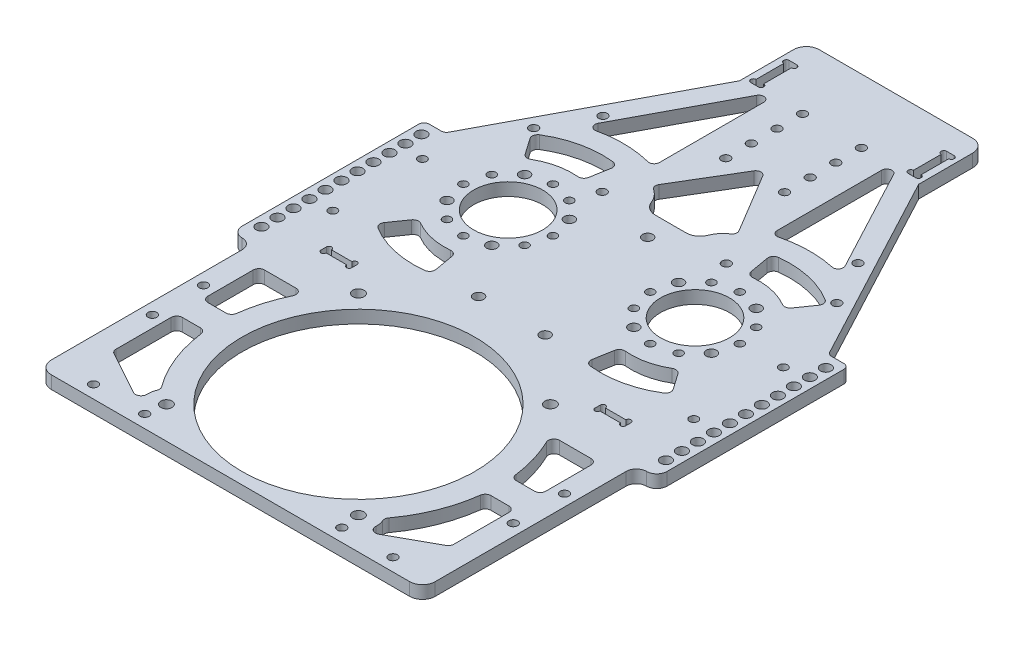
from build123d import *

# Parameters (mm, degrees)
SKETCH_1_R                   = 13.5
SKETCH_1_R_2                 = 1.6
SKETCH_1_R_3                 = 45.5
EXTRUDE_1_DEPTH              = 5
SKETCH_3_R                   = 1.7
CUT_EXTRUDE_2_DEPTH          = 164.324829711
SKETCH_4_R                   = 2.2
CUT_EXTRUDE_3_DEPTH          = 164.324829711
CUT_EXTRUDE_4_DEPTH          = 10
CUT_EXTRUDE_5_DEPTH          = 10
FILLET_1_DEPTH               = 5
CUT_EXTRUDE_6_DEPTH          = 10
FILLET_2_R                   = 2
CUT_EXTRUDE_7_DEPTH          = 164.324829711
FILLET_3_R                   = 2
FILLET_5_R                   = 5
SKETCH_9_R                   = 1.05
SKETCH_9_W                   = 3
SKETCH_9_H                   = 15
CUT_EXTRUDE_8_DEPTH          = 164.324829711
FILLET_3_OF_MIRROR_1_R       = 2
FILLET_6_R                   = 20
EXTRUDE_START                = -5
EXTRUDE_2_DEPTH              = 5
FILLET_7_R                   = 2.2
SKETCH_12_R                  = 1
SKETCH_12_W                  = 12
SKETCH_12_H                  = 2.1
CUT_EXTRUDE_10_DEPTH         = 10
SKETCH_14_R                  = 1.5
CUT_EXTRUDE_11_DEPTH         = 164.324829711
CUT_EXTRUDE_12_DEPTH         = 164.324829711
FILLET_8_R                   = 10
SKETCH_16_W                  = 8
SKETCH_16_H                  = 75.05079277
EXTRUDE_3_DEPTH              = 5
FILLET_START                 = -1
FILLET_9_DEPTH               = 7
FILLET_9_2_DEPTH             = 5
SKETCH_17_R                  = 1.65
CUT_EXTRUDE_13_DEPTH         = 168.149633702
SKETCH_18_R                  = 2.1
CUT_EXTRUDE_14_DEPTH         = 168.149633702
SKETCH_20_R                  = 2
CUT_EXTRUDE_16_DEPTH         = 10
SKETCH_23_R                  = 1.65
CUT_EXTRUDE_17_DEPTH         = 10
FILLET_10_R                  = 2
SKETCH_19_R                  = 2
CUT_EXTRUDE_18_DEPTH         = 10
SKETCH_24_R                  = 2
CUT_EXTRUDE_19_DEPTH         = 10
SKETCH_25_W                  = 49.263318026
SKETCH_25_H                  = 14.404478955
EXTRUDE_4_DEPTH              = 5
HOLE_WIZARD_M3_1_D           = 3.4
HOLE_WIZARD_M3_1_DEPTH       = 7.5
HOLE_WIZARD_M3_1_CSINK_D     = 6.72
HOLE_WIZARD_M3_1_CSINK_ANGLE = 90
HOLE_WIZARD_M3_1_TIP         = 1.021463052


with BuildPart() as part:
    # 草图1 → 凸台-拉伸1 (new body)
    with BuildSketch(Plane(origin=(0, 0, 0), x_dir=(1, 0, 0), z_dir=(0, 1, 0))):
        Polygon((-35, 88.881349096), (-75, 13.627385249), (-75, -145), (75, -145), (75, 13.627385249), (35, 88.881349096), (35, 115), (-35, 115), align=None)
        with Locations(Location((36.5, 0, 0), (0, 0, 270))):
            Circle(SKETCH_1_R, mode=Mode.SUBTRACT)
        with Locations(Location((-36.5, 0, 0), (0, 0, 270))):
            Circle(SKETCH_1_R, mode=Mode.SUBTRACT)
        with Locations(Location((36.5, 17.5, 0), (0, 0, 270))):
            Circle(SKETCH_1_R_2, mode=Mode.SUBTRACT)
        with Locations(Location((51.655444566, 8.75, 0), (0, 0, 270))):
            Circle(SKETCH_1_R_2, mode=Mode.SUBTRACT)
        with Locations(Location((54, 0, 0), (0, 0, 270))):
            Circle(SKETCH_1_R_2, mode=Mode.SUBTRACT)
        with Locations(Location((45.25, -15.155444566, 0), (0, 0, 270))):
            Circle(SKETCH_1_R_2, mode=Mode.SUBTRACT)
        with Locations(Location((36.5, -17.5, 0), (0, 0, 270))):
            Circle(SKETCH_1_R_2, mode=Mode.SUBTRACT)
        with Locations(Location((21.344555434, -8.75, 0), (0, 0, 270))):
            Circle(SKETCH_1_R_2, mode=Mode.SUBTRACT)
        with Locations(Location((19, 0, 0), (0, 0, 270))):
            Circle(SKETCH_1_R_2, mode=Mode.SUBTRACT)
        with Locations(Location((27.75, 15.155444566, 0), (0, 0, 270))):
            Circle(SKETCH_1_R_2, mode=Mode.SUBTRACT)
        with Locations(Location((27.75, -15.155444566, 0), (0, 0, 270))):
            Circle(SKETCH_1_R_2, mode=Mode.SUBTRACT)
        with Locations(Location((21.344555434, 8.75, 0), (0, 0, 270))):
            Circle(SKETCH_1_R_2, mode=Mode.SUBTRACT)
        with Locations(Location((45.25, 15.155444566, 0), (0, 0, 270))):
            Circle(SKETCH_1_R_2, mode=Mode.SUBTRACT)
        with Locations(Location((51.655444566, -8.75, 0), (0, 0, 270))):
            Circle(SKETCH_1_R_2, mode=Mode.SUBTRACT)
        with Locations(Location((-36.5, -17.5, 0), (0, 0, 270))):
            Circle(SKETCH_1_R_2, mode=Mode.SUBTRACT)
        with Locations(Location((-45.25, -15.155444566, 0), (0, 0, 270))):
            Circle(SKETCH_1_R_2, mode=Mode.SUBTRACT)
        with Locations(Location((-51.655444566, 8.75, 0), (0, 0, 270))):
            Circle(SKETCH_1_R_2, mode=Mode.SUBTRACT)
        with Locations(Location((-36.5, 17.5, 0), (0, 0, 270))):
            Circle(SKETCH_1_R_2, mode=Mode.SUBTRACT)
        with Locations(Location((-27.75, 15.155444566, 0), (0, 0, 270))):
            Circle(SKETCH_1_R_2, mode=Mode.SUBTRACT)
        with Locations(Location((-21.344555434, -8.75, 0), (0, 0, 270))):
            Circle(SKETCH_1_R_2, mode=Mode.SUBTRACT)
        with Locations(Location((-21.344555434, 8.75, 0), (0, 0, 270))):
            Circle(SKETCH_1_R_2, mode=Mode.SUBTRACT)
        with Locations(Location((-19, 0, 0), (0, 0, 270))):
            Circle(SKETCH_1_R_2, mode=Mode.SUBTRACT)
        with Locations(Location((-27.75, -15.155444566, 0), (0, 0, 270))):
            Circle(SKETCH_1_R_2, mode=Mode.SUBTRACT)
        with Locations(Location((-51.655444566, -8.75, 0), (0, 0, 270))):
            Circle(SKETCH_1_R_2, mode=Mode.SUBTRACT)
        with Locations(Location((-54, 0, 0), (0, 0, 270))):
            Circle(SKETCH_1_R_2, mode=Mode.SUBTRACT)
        with Locations(Location((-45.25, 15.155444566, 0), (0, 0, 270))):
            Circle(SKETCH_1_R_2, mode=Mode.SUBTRACT)
        with Locations(Location((0, -95, 0), (0, 0, 270))):
            Circle(SKETCH_1_R_3, mode=Mode.SUBTRACT)
    extrude(amount=EXTRUDE_1_DEPTH)

    # 草图3 → 切除-拉伸2 (cut, through all)
    with BuildSketch(Plane(origin=(0, 5, 0), x_dir=(1, 0, 0), z_dir=(0, 1, 0))):
        with Locations(Location((49.82296811, 50.341150246, 0), (0, 0, 270))):
            Circle(SKETCH_3_R)
        with Locations(Location((59.209976564, 32.680910376, 0), (0, 0, 270))):
            Circle(SKETCH_3_R)
        with Locations(Location((24.25, 24.5, 0), (0, 0, 270))):
            Circle(SKETCH_3_R)
        with Locations(Location((70.5, -85, 0), (0, 0, 270))):
            Circle(SKETCH_3_R)
        with Locations(Location((70.5, -105, 0), (0, 0, 270))):
            Circle(SKETCH_3_R)
        with Locations(Location((58.5, -140, 0), (0, 0, 270))):
            Circle(SKETCH_3_R)
        with Locations(Location((38.5, -140, 0), (0, 0, 270))):
            Circle(SKETCH_3_R)
        with Locations(Location((21, 103, 0), (0, 0, 270))):
            Circle(SKETCH_3_R)
        with Locations(Location((-21, 103, 0), (0, 0, 90))):
            Circle(SKETCH_3_R)
        with Locations(Location((-38.5, -140, 0), (0, 0, 90))):
            Circle(SKETCH_3_R)
        with Locations(Location((-58.5, -140, 0), (0, 0, 90))):
            Circle(SKETCH_3_R)
        with Locations(Location((-70.5, -105, 0), (0, 0, 90))):
            Circle(SKETCH_3_R)
        with Locations(Location((-70.5, -85, 0), (0, 0, 90))):
            Circle(SKETCH_3_R)
        with Locations(Location((-24.25, 24.5, 0), (0, 0, 90))):
            Circle(SKETCH_3_R)
        with Locations(Location((-59.209976564, 32.680910376, 0), (0, 0, 90))):
            Circle(SKETCH_3_R)
        with Locations(Location((-49.82296811, 50.341150246, 0), (0, 0, 90))):
            Circle(SKETCH_3_R)
    extrude(amount=-CUT_EXTRUDE_2_DEPTH, mode=Mode.SUBTRACT)

    # 草图4 → 切除-拉伸3 (cut, through all)
    with BuildSketch(Plane(origin=(0, 5, 0), x_dir=(1, 0, 0), z_dir=(0, 1, 0))):
        with Locations(Location((37.500010402, -57.500010402, 0), (0, 0, 270))):
            Circle(SKETCH_4_R)
        with Locations(Location((37.499989598, -132.500010402, 0), (0, 0, 270))):
            Circle(SKETCH_4_R)
        with Locations(Location((-37.500010402, -132.499989598, 0), (0, 0, 270))):
            Circle(SKETCH_4_R)
        with Locations(Location((-37.499989598, -57.499989598, 0), (0, 0, 270))):
            Circle(SKETCH_4_R)
    extrude(amount=-CUT_EXTRUDE_3_DEPTH, mode=Mode.SUBTRACT)

    # 草图5 → 切除-拉伸4 (cut)
    with BuildSketch(Plane(origin=(0, 5, 0), x_dir=(1, 0, 0), z_dir=(0, 1, 0))):
        with BuildLine():
            ThreePointArc((57.722328145, 30.308625639), (44.508265716, 36.122952263), (30.075017426, 36.437886861))
            Line((30.075017426, 36.437886861), (32.158795558, 24.620193825))
            ThreePointArc((32.158795558, 24.620193825), (41.910990348, 24.407400178), (50.839410909, 20.478801107))
            Line((50.839410909, 20.478801107), (57.722328145, 30.308625639))
        make_face()
        with BuildLine():
            Line((57.722328145, -30.308625639), (50.839410909, -20.478801107))
            ThreePointArc((50.839410909, -20.478801107), (41.910990348, -24.407400178), (32.158795558, -24.620193825))
            Line((32.158795558, -24.620193825), (30.075017426, -36.437886861))
            ThreePointArc((30.075017426, -36.437886861), (44.508265716, -36.122952263), (57.722328145, -30.308625639))
        make_face()
    cut_extrude_4 = extrude(amount=-CUT_EXTRUDE_4_DEPTH, mode=Mode.SUBTRACT)

    # 草图6 → 切除-拉伸5 (cut)
    with BuildSketch(Plane(origin=(0, 5, 0), x_dir=(1, 0, 0), z_dir=(0, 1, 0))):
        with BuildLine():
            Line((54.772255751, -90), (66, -90))
            Line((66, -90), (66, -40))
            Line((66, -40), (35.155020781, -50.800280654))
            ThreePointArc((35.155020781, -50.800280654), (41.609354889, -51.710460841), (44.601387055, -57.501367529))
            ThreePointArc((44.601387055, -57.501367529), (44.316479978, -59.49247487), (43.484624113, -61.323784866))
            ThreePointArc((43.484624113, -61.323784866), (51.177973179, -74.855148021), (54.772255751, -90))
        make_face()
        with BuildLine():
            Line((40.977955081, -138.804275316), (66, -125))
            Line((66, -125), (66, -100))
            Line((66, -100), (54.772255751, -100))
            ThreePointArc((54.772255751, -100), (51.197014926, -115.096409198), (43.548287119, -128.593848975))
            ThreePointArc((43.548287119, -128.593848975), (44.406064538, -130.463805863), (44.699989598, -132.500010402))
            ThreePointArc((44.699989598, -132.500010402), (43.700044093, -136.160519146), (40.977955081, -138.804275316))
        make_face()
    cut_extrude_5 = extrude(amount=-CUT_EXTRUDE_5_DEPTH, mode=Mode.SUBTRACT)

    # 圆角1: read off the stored shape, not the designer's step
    # 圆角1 outline → 圆角1 (add)
    with BuildSketch(Plane(origin=(0, 0, 0), x_dir=(1, 0, 0), z_dir=(0, 1, 0))):
        with BuildLine():
            ThreePointArc((41.960642067, -51.976420042), (41.174517984, -49.889816616), (42.615339986, -48.188071367))
            Line((42.615339986, -48.188071367), (35.155020781, -50.800280654))
            ThreePointArc((35.155020781, -50.800280654), (38.710477899, -50.505075702), (41.960642067, -51.976420042))
        make_face()
        with BuildLine():
            ThreePointArc((44.303017676, -62.407936169), (43.890494612, -61.363736932), (44.046939144, -60.251957982))
            ThreePointArc((44.046939144, -60.251957982), (43.788663301, -60.799875889), (43.484624113, -61.323784866))
            ThreePointArc((43.484624113, -61.323784866), (43.897168004, -61.863333884), (44.303017676, -62.407936169))
        make_face()
        with BuildLine():
            Line((66, -90), (66, -87.8))
            ThreePointArc((66, -87.8), (65.355634919, -89.355634919), (63.8, -90))
            Line((63.8, -90), (66, -90))
        make_face()
        with BuildLine():
            ThreePointArc((56.745043836, -90), (55.290607652, -89.450640901), (54.56254215, -88.076923077))
            ThreePointArc((54.56254215, -88.076923077), (54.675854491, -89.037539453), (54.772255751, -90))
            Line((54.772255751, -90), (56.745043836, -90))
        make_face()
        with BuildLine():
            ThreePointArc((49.136056437, -21.571510789), (50.717433134, -21.320464273), (52.0501639, -22.207935579))
            Line((52.0501639, -22.207935579), (50.839410909, -20.478801107))
            ThreePointArc((50.839410909, -20.478801107), (49.998794881, -21.04239855), (49.136056437, -21.571510789))
        make_face()
        with BuildLine():
            Line((57.722328145, -30.308625639), (56.420533416, -28.449470091))
            ThreePointArc((56.420533416, -28.449470091), (56.771810685, -30.161691184), (55.763814942, -31.589641243))
            ThreePointArc((55.763814942, -31.589641243), (56.753202111, -30.964621817), (57.722328145, -30.308625639))
        make_face()
        with BuildLine():
            ThreePointArc((31.792244499, -26.699008186), (32.62504719, -25.331449672), (34.164358047, -24.890656413))
            ThreePointArc((34.164358047, -24.890656413), (33.158838982, -24.775726892), (32.158795558, -24.620193825))
            Line((32.158795558, -24.620193825), (31.792244499, -26.699008186))
        make_face()
        with BuildLine():
            ThreePointArc((30.075017426, -36.437886861), (31.230579862, -36.622850946), (32.391413782, -36.771177833))
            ThreePointArc((32.391413782, -36.771177833), (30.874381618, -35.903012984), (30.469131041, -34.202757485))
            Line((30.469131041, -34.202757485), (30.075017426, -36.437886861))
        make_face()
        with BuildLine():
            ThreePointArc((34.164358047, 24.890656413), (32.62504719, 25.331449672), (31.792244499, 26.699008186))
            Line((31.792244499, 26.699008186), (32.158795558, 24.620193825))
            ThreePointArc((32.158795558, 24.620193825), (33.158838982, 24.775726892), (34.164358047, 24.890656413))
        make_face()
        with BuildLine():
            Line((30.075017426, 36.437886861), (30.469131041, 34.202757485))
            ThreePointArc((30.469131041, 34.202757485), (30.874381618, 35.903012984), (32.391413782, 36.771177834))
            ThreePointArc((32.391413782, 36.771177834), (31.230579862, 36.622850946), (30.075017426, 36.437886861))
        make_face()
        with BuildLine():
            ThreePointArc((52.0501639, 22.207935579), (50.717433134, 21.320464273), (49.136056437, 21.571510789))
            ThreePointArc((49.136056437, 21.571510789), (49.998794881, 21.04239855), (50.839410909, 20.478801107))
            Line((50.839410909, 20.478801107), (52.0501639, 22.207935579))
        make_face()
        with BuildLine():
            ThreePointArc((57.722328145, 30.308625639), (56.753202111, 30.964621817), (55.763814942, 31.589641243))
            ThreePointArc((55.763814942, 31.589641243), (56.771810685, 30.161691184), (56.420533416, 28.449470091))
            Line((56.420533416, 28.449470091), (57.722328145, 30.308625639))
        make_face()
        with BuildLine():
            ThreePointArc((54.56254215, -101.923076923), (55.290607652, -100.549359099), (56.745043836, -100))
            Line((56.745043836, -100), (54.772255751, -100))
            ThreePointArc((54.772255751, -100), (54.675854491, -100.962460547), (54.56254215, -101.923076923))
        make_face()
        with BuildLine():
            Line((66, -100), (63.8, -100))
            ThreePointArc((63.8, -100), (65.355634919, -100.644365081), (66, -102.2))
            Line((66, -102.2), (66, -100))
        make_face()
        with BuildLine():
            ThreePointArc((44.119965044, -129.668769492), (43.957031096, -128.553274323), (44.36801473, -127.503527022))
            ThreePointArc((44.36801473, -127.503527022), (43.961531288, -128.051229429), (43.548287119, -128.593848975))
            ThreePointArc((43.548287119, -128.593848975), (43.85688731, -129.119204067), (44.119965044, -129.668769492))
        make_face()
        with BuildLine():
            Line((66, -125), (66, -123.701121217))
            ThreePointArc((66, -123.701121217), (65.694461096, -124.81961), (64.862711675, -125.627424385))
            Line((64.862711675, -125.627424385), (66, -125))
        make_face()
        with BuildLine():
            ThreePointArc((47.94758218, -134.959239803), (45.7131074, -134.894917092), (44.688409016, -132.908209218))
            ThreePointArc((44.688409016, -132.908209218), (43.593743824, -136.334871473), (40.977955081, -138.804275316))
            Line((40.977955081, -138.804275316), (47.94758218, -134.959239803))
        make_face()
    fillet_1 = extrude(amount=FILLET_1_DEPTH)

    # 草图7 → 切除-拉伸6 (cut)
    with BuildSketch(Plane.XZ):
        Polygon((17.467619242, -35), (-17.467619242, -35), (0, -64.112698737), align=None)
    extrude(amount=-CUT_EXTRUDE_6_DEPTH, mode=Mode.SUBTRACT)

    # 圆角2
    fillet_2_edges = [part.edges().sort_by_distance(p)[0] for p in [
        (17.467619242, 2.5, -35),
        (0, 2.5, -64.112698737),
        (-17.467619242, 2.5, -35),
    ]]
    fillet(fillet_2_edges, radius=FILLET_2_R)

    # 草图8 → 切除-拉伸7 (cut, through all)
    with BuildSketch(Plane.XZ):
        with BuildLine():
            Line((-50.441337655, -42.785968546), (-23, -94.412704341))
            Line((-23, -94.412704341), (-23, -42.927264064))
            ThreePointArc((-23, -42.927264064), (-36.731702044, -44.999403487), (-50.441337655, -42.785968546))
        make_face()
    cut_extrude_7 = extrude(amount=-CUT_EXTRUDE_7_DEPTH, mode=Mode.SUBTRACT)

    # 圆角3
    fillet_3_edges = [part.edges().sort_by_distance(p)[0] for p in [
        (-23, 2.5, -42.927264064),
        (-23, 2.5, -94.412704341),
        (-50.441337655, 2.5, -42.785968546),
    ]]
    fillet(fillet_3_edges, radius=FILLET_3_R)

    # 圆角5
    fillet_5_edges = [part.edges().sort_by_distance(p)[0] for p in [
        (75, 2.5, 145),
        (-75, 2.5, 145),
        (-35, 2.5, -115),
        (35, 2.5, -115),
    ]]
    fillet(fillet_5_edges, radius=FILLET_5_R)

    # 草图9 → 切除-拉伸8 (cut, through all)
    with BuildSketch(Plane.XZ):
        with Locations((29.25, -91.55)):
            Circle(SKETCH_9_R)
        with Locations((29.25, -104.45)):
            Circle(SKETCH_9_R)
        with Locations((32.25, -104.45)):
            Circle(SKETCH_9_R)
        with Locations((32.25, -91.55)):
            Circle(SKETCH_9_R)
        with Locations((30.75, -98)):
            Rectangle(SKETCH_9_W, SKETCH_9_H)
        with BuildLine():
            ThreePointArc((29.25, -90.5), (28.2, -91.55), (29.25, -92.6))
            Line((29.25, -92.6), (29.25, -90.5))
        make_face()
        with BuildLine():
            Line((29.25, -90.5), (29.25, -92.6))
            ThreePointArc((29.25, -92.6), (29.99246212, -92.29246212), (30.3, -91.55))
            ThreePointArc((30.3, -91.55), (29.99246212, -90.80753788), (29.25, -90.5))
        make_face()
        with BuildLine():
            ThreePointArc((32.25, -90.5), (31.2, -91.55), (32.25, -92.6))
            Line((32.25, -92.6), (32.25, -90.5))
        make_face()
        with BuildLine():
            Line((32.25, -90.5), (32.25, -92.6))
            ThreePointArc((32.25, -92.6), (32.99246212, -92.29246212), (33.3, -91.55))
            ThreePointArc((33.3, -91.55), (32.99246212, -90.80753788), (32.25, -90.5))
        make_face()
        with BuildLine():
            ThreePointArc((32.25, -103.4), (31.2, -104.45), (32.25, -105.5))
            Line((32.25, -105.5), (32.25, -103.4))
        make_face()
        with BuildLine():
            Line((32.25, -103.4), (32.25, -105.5))
            ThreePointArc((32.25, -105.5), (32.99246212, -105.19246212), (33.3, -104.45))
            ThreePointArc((33.3, -104.45), (32.99246212, -103.70753788), (32.25, -103.4))
        make_face()
        with BuildLine():
            ThreePointArc((29.25, -103.4), (28.2, -104.45), (29.25, -105.5))
            Line((29.25, -105.5), (29.25, -103.4))
        make_face()
        with BuildLine():
            Line((29.25, -103.4), (29.25, -105.5))
            ThreePointArc((29.25, -105.5), (29.99246212, -105.19246212), (30.3, -104.45))
            ThreePointArc((30.3, -104.45), (29.99246212, -103.70753788), (29.25, -103.4))
        make_face()
    cut_extrude_8 = extrude(amount=-CUT_EXTRUDE_8_DEPTH, mode=Mode.SUBTRACT)

    # 镜向1: 切除-拉伸4, 切除-拉伸5, 圆角1, 切除-拉伸7, 切除-拉伸8 across plane
    add(cut_extrude_4.mirror(Plane(origin=(0, 0, 0), x_dir=(0, 0, 1), z_dir=(1, 0, 0))), mode=Mode.SUBTRACT)
    add(cut_extrude_5.mirror(Plane(origin=(0, 0, 0), x_dir=(0, 0, 1), z_dir=(1, 0, 0))), mode=Mode.SUBTRACT)
    add(fillet_1.mirror(Plane(origin=(0, 0, 0), x_dir=(0, 0, 1), z_dir=(1, 0, 0))))
    add(cut_extrude_7.mirror(Plane(origin=(0, 0, 0), x_dir=(0, 0, 1), z_dir=(1, 0, 0))), mode=Mode.SUBTRACT)
    add(cut_extrude_8.mirror(Plane(origin=(0, 0, 0), x_dir=(0, 0, 1), z_dir=(1, 0, 0))), mode=Mode.SUBTRACT)

    # 圆角3 of 镜向1
    fillet_3_of_mirror_1_edges = [part.edges().sort_by_distance(p)[0] for p in [
        (23, 2.5, -42.927264064),
        (23, 2.5, -94.412704341),
        (50.441337655, 2.5, -42.785968546),
    ]]
    fillet(fillet_3_of_mirror_1_edges, radius=FILLET_3_OF_MIRROR_1_R)

    # 圆角6
    # the kernel refuses this fillet: 20 mm, written as the material it adds along each edge
    with BuildSketch(Plane(origin=(-66, 5, 40), x_dir=(0.9438150528666441, 0, 0.33047412301469803), z_dir=(0, -1, 0))) as fillet_6_piece_1:
        with BuildLine():
            CenterArc((28.096394515, 19.722573178), FILLET_6_R, 160.702444654, 99.743227102)
            Line((9.220093458, 26.332055639), (0, 0))
            Line((0, 0), (24.776739832, 0))
        make_face()
    extrude(amount=5)
    with BuildSketch(Plane(origin=(66, 5, 40), x_dir=(0, 0, 1), z_dir=(0, -1, 0))) as fillet_6_piece_2:
        with BuildLine():
            CenterArc((27.899592784, 20), FILLET_6_R, 170.256772898, 99.743227102)
            Line((8.188071367, 23.384660014), (0, 0))
            Line((0, 0), (27.899592784, 0))
        make_face()
    extrude(amount=5)

    # 草图10 → 凸台-拉伸2 (add)
    with BuildSketch(Plane.XZ.offset(EXTRUDE_START)):
        with BuildLine():
            ThreePointArc((-44.303017676, 62.407936169), (-46.16318242, 65.100826284), (-47.859878069, 67.899592784))
            Line((-47.859878069, 67.899592784), (-66, 67.899592784))
            ThreePointArc((-66, 67.899592784), (-58.890050421, 52.607549097), (-42.615339986, 48.188071367))
            ThreePointArc((-42.615339986, 48.188071367), (-41.174517984, 49.889816616), (-41.960642067, 51.976420042))
            ThreePointArc((-41.960642067, 51.976420042), (-44.385976867, 55.765734183), (-44.046939144, 60.251957982))
            ThreePointArc((-44.046939144, 60.251957982), (-43.890494612, 61.363736932), (-44.303017676, 62.407936169))
        make_face()
        with BuildLine():
            ThreePointArc((42.615339986, 48.188071367), (58.890050421, 52.607549097), (66, 67.899592784))
            Line((66, 67.899592784), (47.859878069, 67.899592784))
            ThreePointArc((47.859878069, 67.899592784), (46.16318242, 65.100826284), (44.303017676, 62.407936169))
            ThreePointArc((44.303017676, 62.407936169), (43.890494612, 61.363736932), (44.046939144, 60.251957982))
            ThreePointArc((44.046939144, 60.251957982), (44.385976867, 55.765734183), (41.960642067, 51.976420042))
            ThreePointArc((41.960642067, 51.976420042), (41.174517984, 49.889816616), (42.615339986, 48.188071367))
        make_face()
    extrude(amount=EXTRUDE_2_DEPTH)

    # 圆角7
    fillet_7_edges = [part.edges().sort_by_distance(p)[0] for p in [
        (-66, 2.5, 67.899592784),
        (66, 2.5, 67.899592784),
        (-47.859878069, 2.5, 67.899592784),
        (47.859878069, 2.5, 67.899592784),
    ]]
    fillet(fillet_7_edges, radius=FILLET_7_R)

    # 草图12 → 切除-拉伸10 (cut)
    with BuildSketch(Plane.XZ):
        with Locations((48.5, 50.1)):
            Circle(SKETCH_12_R)
        with Locations((48.5, 48)):
            Circle(SKETCH_12_R)
        with Locations((58.5, 50.1)):
            Circle(SKETCH_12_R)
        with Locations((58.5, 48)):
            Circle(SKETCH_12_R)
        with Locations((53.5, 49.05)):
            Rectangle(SKETCH_12_W, SKETCH_12_H)
    cut_extrude_10 = extrude(amount=-CUT_EXTRUDE_10_DEPTH, mode=Mode.SUBTRACT)

    # 镜向2: 切除-拉伸10 across plane
    add(cut_extrude_10.mirror(Plane(origin=(0, 0, 0), x_dir=(0, 0, 1), z_dir=(1, 0, 0))), mode=Mode.SUBTRACT)

    # 草图14 → 切除-拉伸11 (cut, through all)
    with BuildSketch(Plane(origin=(0, 5, 0), x_dir=(1, 0, 0), z_dir=(0, 1, 0))):
        with Locations(Location((-13, -35.04, 0), (0, 0, 270))):
            Circle(SKETCH_14_R)
        with Locations(Location((13, -35.04, 0), (0, 0, 270))):
            Circle(SKETCH_14_R)
        with Locations(Location((0, 18, 0), (0, 0, 270))):
            Circle(SKETCH_14_R)
    extrude(amount=-CUT_EXTRUDE_11_DEPTH, mode=Mode.SUBTRACT)

    # 草图15 → 切除-拉伸12 (cut, through all)
    with BuildSketch(Plane(origin=(0, 5, 0), x_dir=(1, 0, 0), z_dir=(0, 1, 0))):
        with BuildLine():
            Line((-6, 38), (6, 38))
            ThreePointArc((6, 38), (11.5, 32.5), (6, 27))
            Line((6, 27), (-6, 27))
            ThreePointArc((-6, 27), (-11.5, 32.5), (-6, 38))
        make_face()
    extrude(amount=-CUT_EXTRUDE_12_DEPTH, mode=Mode.SUBTRACT)

    # 圆角8
    fillet_8_edges = [part.edges().sort_by_distance(p)[0] for p in [
        (10.898979486, 2.5, -35),
        (-10.898979486, 2.5, -35),
    ]]
    fillet(fillet_8_edges, radius=FILLET_8_R)

    # 草图16 → 凸台-拉伸3 (add)
    with BuildSketch(Plane.XZ):
        with Locations((79, 23.898011136)):
            Rectangle(SKETCH_16_W, SKETCH_16_H)
        with Locations((-79, 23.898011136)):
            Rectangle(SKETCH_16_W, SKETCH_16_H)
    extrude(amount=-EXTRUDE_3_DEPTH)

    # 圆角9: read off the stored shape, not the designer's step
    # 圆角9 outline → 圆角9 (cut)
    with BuildSketch(Plane(origin=(0, 0, 0), x_dir=(1, 0, 0), z_dir=(0, 1, 0)).offset(FILLET_START)):
        with BuildLine():
            Line((-83, -61.423407521), (-79, -61.423407521))
            ThreePointArc((-79, -61.423407521), (-81.828427125, -60.251834646), (-83, -57.423407521))
            Line((-83, -57.423407521), (-83, -61.423407521))
        make_face()
        with BuildLine():
            ThreePointArc((83, -57.423407521), (81.828427125, -60.251834646), (79, -61.423407521))
            Line((79, -61.423407521), (83, -61.423407521))
            Line((83, -61.423407521), (83, -57.423407521))
        make_face()
    extrude(amount=FILLET_9_DEPTH, mode=Mode.SUBTRACT)

    # Fillet 9 2 outline → Fillet 9 2 (add)
    with BuildSketch(Plane(origin=(0, 0, 0), x_dir=(1, 0, 0), z_dir=(0, 1, 0))):
        with BuildLine():
            Line((-75, -61.423407521), (-79, -61.423407521))
            ThreePointArc((-79, -61.423407521), (-76.171572875, -62.594980396), (-75, -65.423407521))
            Line((-75, -65.423407521), (-75, -61.423407521))
        make_face()
        with BuildLine():
            ThreePointArc((75, -65.423407521), (76.171572875, -62.594980396), (79, -61.423407521))
            Line((79, -61.423407521), (75, -61.423407521))
            Line((75, -61.423407521), (75, -65.423407521))
        make_face()
    extrude(amount=FILLET_9_2_DEPTH)

    # 草图17 → 切除-拉伸13 (cut, through all)
    with BuildSketch(Plane(origin=(0, 5, 0), x_dir=(1, 0, 0), z_dir=(0, 1, 0))):
        with Locations(Location((70.5, 0.500036, 0), (0, 0, 270))):
            Circle(SKETCH_17_R)
        with Locations(Location((70.5, -34.499964, 0), (0, 0, 270))):
            Circle(SKETCH_17_R)
        with Locations(Location((-70.5, -34.499964, 0), (0, 0, 270))):
            Circle(SKETCH_17_R)
        with Locations(Location((-70.5, 0.500036, 0), (0, 0, 270))):
            Circle(SKETCH_17_R)
    extrude(amount=-CUT_EXTRUDE_13_DEPTH, mode=Mode.SUBTRACT)

    # 草图18 → 切除-拉伸14 (cut, through all)
    with BuildSketch(Plane.XZ):
        with Locations(Location((79, -8.627385249, 0), (0, 0, 270))):
            Circle(SKETCH_18_R)
        with Locations(Location((-79, -8.627385249, 0), (0, 0, 90))):
            Circle(SKETCH_18_R)
        with Locations(Location((79, -2.377385249, 0), (0, 0, 270))):
            Circle(SKETCH_18_R)
        with Locations(Location((-79, -2.377385249, 0), (0, 0, 90))):
            Circle(SKETCH_18_R)
        with Locations(Location((79, 3.872614751, 0), (0, 0, 270))):
            Circle(SKETCH_18_R)
        with Locations(Location((-79, 3.872614751, 0), (0, 0, 90))):
            Circle(SKETCH_18_R)
        with Locations(Location((79, 10.122614751, 0), (0, 0, 270))):
            Circle(SKETCH_18_R)
        with Locations(Location((-79, 10.122614751, 0), (0, 0, 90))):
            Circle(SKETCH_18_R)
        with Locations(Location((79, 16.372614751, 0), (0, 0, 270))):
            Circle(SKETCH_18_R)
        with Locations(Location((-79, 16.372614751, 0), (0, 0, 90))):
            Circle(SKETCH_18_R)
        with Locations(Location((79, 22.622614751, 0), (0, 0, 270))):
            Circle(SKETCH_18_R)
        with Locations(Location((-79, 22.622614751, 0), (0, 0, 90))):
            Circle(SKETCH_18_R)
        with Locations(Location((79, 28.872614751, 0), (0, 0, 270))):
            Circle(SKETCH_18_R)
        with Locations(Location((-79, 28.872614751, 0), (0, 0, 90))):
            Circle(SKETCH_18_R)
        with Locations(Location((79, 35.122614751, 0), (0, 0, 270))):
            Circle(SKETCH_18_R)
        with Locations(Location((-79, 35.122614751, 0), (0, 0, 90))):
            Circle(SKETCH_18_R)
        with Locations(Location((79, 41.372614751, 0), (0, 0, 270))):
            Circle(SKETCH_18_R)
        with Locations(Location((-79, 41.372614751, 0), (0, 0, 90))):
            Circle(SKETCH_18_R)
        with Locations(Location((79, 47.622614751, 0), (0, 0, 270))):
            Circle(SKETCH_18_R)
        with Locations(Location((-79, 47.622614751, 0), (0, 0, 90))):
            Circle(SKETCH_18_R)
        with Locations(Location((79, 53.872614751, 0), (0, 0, 270))):
            Circle(SKETCH_18_R)
        with Locations(Location((-79, 53.872614751, 0), (0, 0, 90))):
            Circle(SKETCH_18_R)
    extrude(amount=-CUT_EXTRUDE_14_DEPTH, mode=Mode.SUBTRACT)

    # 草图20 → 切除-拉伸16 (cut)
    with BuildSketch(Plane(origin=(0, 5, 0), x_dir=(1, 0, 0), z_dir=(0, 1, 0))):
        with Locations(Location((21.344555434, 8.75, 0), (0, 0, 270))):
            Circle(SKETCH_20_R)
        with Locations(Location((45.25, 15.155444566, 0), (0, 0, 270))):
            Circle(SKETCH_20_R)
        with Locations(Location((51.655444566, -8.75, 0), (0, 0, 270))):
            Circle(SKETCH_20_R)
        with Locations(Location((27.75, -15.155444566, 0), (0, 0, 270))):
            Circle(SKETCH_20_R)
    extrude(amount=-CUT_EXTRUDE_16_DEPTH, mode=Mode.SUBTRACT)

    # 草图23 → 切除-拉伸17 (cut)
    with BuildSketch(Plane.XZ):
        with Locations(Location((11.5, -60, 0), (0, 0, 270))):
            Circle(SKETCH_23_R)
        with Locations(Location((-11.5, -60, 0), (0, 0, 270))):
            Circle(SKETCH_23_R)
        with Locations(Location((11.5, -80, 0), (0, 0, 270))):
            Circle(SKETCH_23_R)
        with Locations(Location((-11.5, -80, 0), (0, 0, 270))):
            Circle(SKETCH_23_R)
        with Locations(Location((-11.5, -70, 0), (0, 0, 270))):
            Circle(SKETCH_23_R)
        with Locations(Location((11.5, -70, 0), (0, 0, 270))):
            Circle(SKETCH_23_R)
        with Locations(Location((-11.5, -90, 0), (0, 0, 270))):
            Circle(SKETCH_23_R)
        with Locations(Location((11.5, -90, 0), (0, 0, 270))):
            Circle(SKETCH_23_R)
    extrude(amount=-CUT_EXTRUDE_17_DEPTH, mode=Mode.SUBTRACT)

    # 圆角10
    fillet_10_edges = [part.edges().sort_by_distance(p)[0] for p in [
        (75, 2.5, -13.627385249),
        (-75, 2.5, -13.627385249),
        (83, 2.5, -13.627385249),
        (-83, 2.5, -13.627385249),
    ]]
    fillet(fillet_10_edges, radius=FILLET_10_R)

    # 草图19 → 切除-拉伸18 (cut)
    with BuildSketch(Plane(origin=(0, 5, 0), x_dir=(1, 0, 0), z_dir=(0, 1, 0))):
        with Locations(Location((27.75, -15.155444566, 0), (0, 0, 270))):
            Circle(SKETCH_19_R)
        with Locations(Location((45.25, 15.155444566, 0), (0, 0, 270))):
            Circle(SKETCH_19_R)
        with Locations(Location((51.655444566, -8.75, 0), (0, 0, 270))):
            Circle(SKETCH_19_R)
        with Locations(Location((21.344555434, 8.75, 0), (0, 0, 270))):
            Circle(SKETCH_19_R)
        with Locations(Location((-27.75, -15.155444566, 0), (0, 0, 270))):
            Circle(SKETCH_19_R)
        with Locations(Location((-45.25, 15.155444566, 0), (0, 0, 270))):
            Circle(SKETCH_19_R)
        with Locations(Location((-21.344555434, 8.75, 0), (0, 0, 270))):
            Circle(SKETCH_19_R)
        with Locations(Location((-51.655444566, -8.75, 0), (0, 0, 270))):
            Circle(SKETCH_19_R)
    extrude(amount=-CUT_EXTRUDE_18_DEPTH, mode=Mode.SUBTRACT)

    # 草图24 → 切除-拉伸19 (cut)
    with BuildSketch(Plane(origin=(0, 5, 0), x_dir=(1, 0, 0), z_dir=(0, 1, 0))):
        with Locations(Location((0, 18, 0), (0, 0, 270))):
            Circle(SKETCH_24_R)
        with Locations(Location((13, -35.04, 0), (0, 0, 270))):
            Circle(SKETCH_24_R)
        with Locations(Location((-13, -35.04, 0), (0, 0, 270))):
            Circle(SKETCH_24_R)
    extrude(amount=-CUT_EXTRUDE_19_DEPTH, mode=Mode.SUBTRACT)

    # 草图25 → 凸台-拉伸4 (add)
    with BuildSketch(Plane.XZ):
        with Locations((0.932899879, -103.546706993)):
            Rectangle(SKETCH_25_W, SKETCH_25_H)
    extrude(amount=-EXTRUDE_4_DEPTH)

    # M3 六角凹锥坑螺钉的锥形沉头孔1
    with Locations(Plane(origin=(-11.5, 0, -60), x_dir=(0, 0, -1), z_dir=(0, -1, 0))):
        with Locations((0, 0), (0, 23), (10, 23), (10, 0), (20, 0), (20, 23), (30, 23), (30, 0)):
            CounterSinkHole(HOLE_WIZARD_M3_1_D / 2, HOLE_WIZARD_M3_1_CSINK_D / 2, depth=HOLE_WIZARD_M3_1_DEPTH, counter_sink_angle=HOLE_WIZARD_M3_1_CSINK_ANGLE)
            with Locations((0, 0, -(HOLE_WIZARD_M3_1_DEPTH + HOLE_WIZARD_M3_1_TIP / 2))):  # 118° drill point
                Cone(0, HOLE_WIZARD_M3_1_D / 2, HOLE_WIZARD_M3_1_TIP, mode=Mode.SUBTRACT)


solid = part.part
